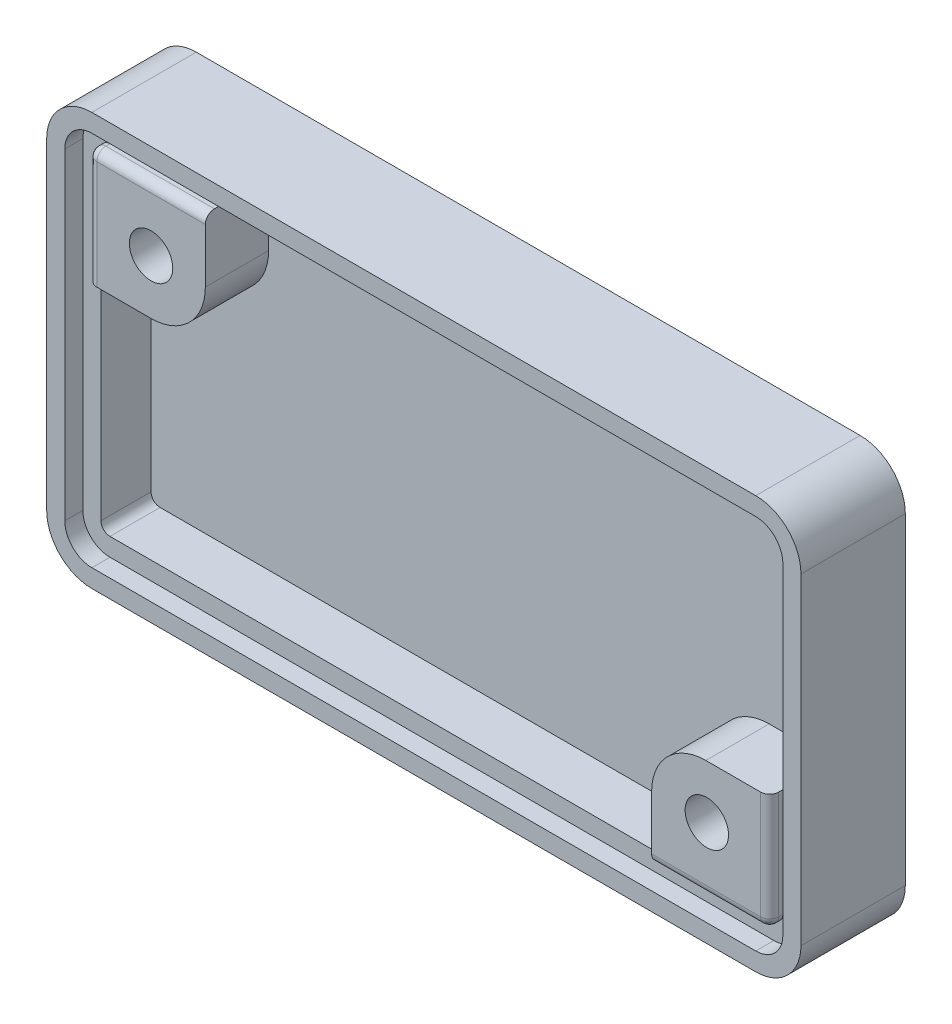
from build123d import *

# Parameters (mm, degrees)
STOCK_PART3_1_START                              = -6
STOCK_PART3_1_DEPTH                              = 2
STOCK_PART3_1_START_2                            = -4
STOCK_PART3_1_2_DEPTH                            = 3.77
BOSS_EXTRUDE1_DEPTH                              = 3.5
CBORE_FOR_M2_PAN_HEAD_MACHINE_SCREW1_D           = 2.4
CBORE_FOR_M2_PAN_HEAD_MACHINE_SCREW1_CBORE_D     = 5
CBORE_FOR_M2_PAN_HEAD_MACHINE_SCREW1_CBORE_DEPTH = 1.6
CUT_EXTRUDE1_START                               = -1
CUT_EXTRUDE1_DEPTH                               = 1
FILLET1_R                                        = 0.5


# Read off the part's stored shape, not the designer's step: Stock-Part3-1
with BuildPart() as part:
    # Stock-Part3-1 outline → Stock-Part3-1 (new body)
    with BuildSketch(Plane.XY.offset(STOCK_PART3_1_START)):
        with BuildLine():
            Line((-36.200000763, -3), (0.5, -3))
            ThreePointArc((0.5, -3), (2.267766953, -2.267766953), (3, -0.5))
            Line((3, -0.5), (3, 17.299999237))
            ThreePointArc((3, 17.299999237), (2.267766953, 19.06776619), (0.5, 19.799999237))
            Line((0.5, 19.799999237), (-36.200000763, 19.799999237))
            ThreePointArc((-36.200000763, 19.799999237), (-37.967767716, 19.06776619), (-38.700000763, 17.299999237))
            Line((-38.700000763, 17.299999237), (-38.700000763, -0.5))
            ThreePointArc((-38.700000763, -0.5), (-37.967767716, -2.267766953), (-36.200000763, -3))
        make_face()
    extrude(amount=STOCK_PART3_1_DEPTH)

    # Stock-Part3-1 2 outline → Stock-Part3-1 2 (add)
    with BuildSketch(Plane.XY.offset(STOCK_PART3_1_START_2)):
        with BuildLine():
            Line((-36.200000763, -3), (0.5, -3))
            ThreePointArc((0.5, -3), (2.267766953, -2.267766953), (3, -0.5))
            Line((3, -0.5), (3, 17.299999237))
            ThreePointArc((3, 17.299999237), (2.267766953, 19.06776619), (0.5, 19.799999237))
            Line((0.5, 19.799999237), (-36.200000763, 19.799999237))
            ThreePointArc((-36.200000763, 19.799999237), (-37.967767716, 19.06776619), (-38.700000763, 17.299999237))
            Line((-38.700000763, 17.299999237), (-38.700000763, -0.5))
            ThreePointArc((-38.700000763, -0.5), (-37.967767716, -2.267766953), (-36.200000763, -3))
        make_face()
        with BuildLine():
            ThreePointArc((1, -0.5), (0.853553391, -0.853553391), (0.5, -1))
            Line((0.5, -1), (-36.200000763, -1))
            ThreePointArc((-36.200000763, -1), (-36.553554154, -0.853553391), (-36.700000763, -0.5))
            Line((-36.700000763, -0.5), (-36.700000763, 17.299999237))
            ThreePointArc((-36.700000763, 17.299999237), (-36.553554154, 17.653552628), (-36.200000763, 17.799999237))
            Line((-36.200000763, 17.799999237), (0.5, 17.799999237))
            ThreePointArc((0.5, 17.799999237), (0.853553391, 17.653552628), (1, 17.299999237))
            Line((1, 17.299999237), (1, -0.5))
        make_face(mode=Mode.SUBTRACT)
    extrude(amount=STOCK_PART3_1_2_DEPTH)

    # Sketch1 → Boss-Extrude1 (add)
    with BuildSketch(Plane.XY.offset(-4)):
        with BuildLine():
            Line((-33.200000683, 11.299999157), (-36.700000763, 11.299999157))
            Line((-36.700000763, 11.299999157), (-36.700000763, 17.299999237))
            ThreePointArc((-36.700000763, 17.299999237), (-36.553554154, 17.653552628), (-36.200000763, 17.799999237))
            Line((-36.200000763, 17.799999237), (-30.200000683, 17.799999237))
            Line((-30.200000683, 17.799999237), (-30.200000683, 14.299999157))
            ThreePointArc((-30.200000683, 14.299999157), (-31.078680339, 12.178678814), (-33.200000683, 11.299999157))
        make_face()
        with BuildLine():
            Line((-2.526751091, 5.473249069), (1, 5.473249069))
            Line((1, 5.473249069), (1, -0.5))
            ThreePointArc((1, -0.5), (0.853553391, -0.853553391), (0.5, -1))
            Line((0.5, -1), (-5.526751091, -1))
            Line((-5.526751091, -1), (-5.526751091, 2.473249069))
            ThreePointArc((-5.526751091, 2.473249069), (-4.648071434, 4.594569413), (-2.526751091, 5.473249069))
        make_face()
    extrude(amount=BOSS_EXTRUDE1_DEPTH)

    # CBORE for M2 Pan Head Machine Screw1 (through all)
    with Locations(Plane(origin=(0, 0, -6), x_dir=(-1, 0, 0), z_dir=(0, 0, -1))):
        with Locations((2.473250112, 2.526750908), (33.200000683, 14.299999157)):
            CounterBoreHole(CBORE_FOR_M2_PAN_HEAD_MACHINE_SCREW1_D / 2, CBORE_FOR_M2_PAN_HEAD_MACHINE_SCREW1_CBORE_D / 2, CBORE_FOR_M2_PAN_HEAD_MACHINE_SCREW1_CBORE_DEPTH)

    # Sketch4 → Cut-Extrude1 (cut)
    with BuildSketch(Plane.XY.offset(-0.23).offset(CUT_EXTRUDE1_START)):
        with BuildLine():
            Line((2, -0.5), (2, 17.299999237))
            ThreePointArc((2, 17.299999237), (1.560660172, 18.360659409), (0.5, 18.799999237))
            Line((0.5, 18.799999237), (-36.200000763, 18.799999237))
            ThreePointArc((-36.200000763, 18.799999237), (-37.260660935, 18.360659409), (-37.700000763, 17.299999237))
            Line((-37.700000763, 17.299999237), (-37.700000763, -0.5))
            ThreePointArc((-37.700000763, -0.5), (-37.260660935, -1.560660172), (-36.200000763, -2))
            Line((-36.200000763, -2), (0.5, -2))
            ThreePointArc((0.5, -2), (1.560660172, -1.560660172), (2, -0.5))
        make_face()
        with BuildLine():
            Line((1, -0.5), (1, 17.299999237))
            ThreePointArc((1, 17.299999237), (0.853553391, 17.653552628), (0.5, 17.799999237))
            Line((0.5, 17.799999237), (-36.200000763, 17.799999237))
            ThreePointArc((-36.200000763, 17.799999237), (-36.553554154, 17.653552628), (-36.700000763, 17.299999237))
            Line((-36.700000763, 17.299999237), (-36.700000763, -0.5))
            ThreePointArc((-36.700000763, -0.5), (-36.553554154, -0.853553391), (-36.200000763, -1))
            Line((-36.200000763, -1), (0.5, -1))
            ThreePointArc((0.5, -1), (0.853553391, -0.853553391), (1, -0.5))
        make_face(mode=Mode.SUBTRACT)
    extrude(amount=CUT_EXTRUDE1_DEPTH, mode=Mode.SUBTRACT)

    # Fillet1
    fillet1_edges = [part.edges().sort_by_distance(p)[0] for p in [
        (-33.200000723, 17.799999237, -0.5),
        (-36.553554154, 17.653552628, -0.5),
        (-36.700000763, 14.299999197, -0.5),
        (-2.513375545, -1, -0.5),
        (0.853553391, -0.853553391, -0.5),
        (1, 2.486624535, -0.5),
    ]]
    fillet(fillet1_edges, radius=FILLET1_R)


solid = part.part
